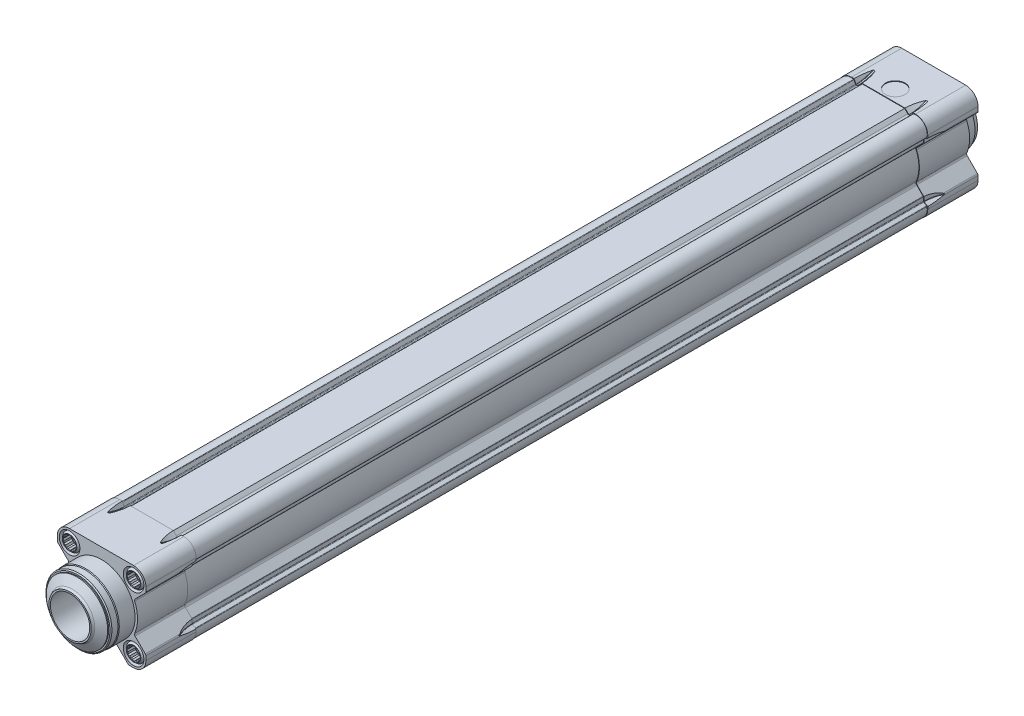
from build123d import *

# Parameters (mm, degrees)
BOSS_EXTRUDE1_DEPTH  = 25.5
SKETCH6_W            = 371.5
SKETCH6_H            = 5
BOSS_EXTRUDE2_START  = -25.5
BOSS_EXTRUDE2_DEPTH  = 25.5
BOSS_EXTRUDE3_DEPTH  = 371.5
SKETCH14_W           = 5
SKETCH14_H           = 0.3
SKETCH15_W           = 21.1
SKETCH15_H           = 5.25
LPATTERN1_COUNT      = 2
LPATTERN1_PITCH      = 32.5
LPATTERN1_COUNT_DIR2 = 2
LPATTERN1_PITCH_DIR2 = 32.5
LPATTERN2_COUNT      = 2
LPATTERN2_PITCH      = 32.5
LPATTERN2_COUNT_DIR2 = 2
LPATTERN2_PITCH_DIR2 = 32.5
CUT_EXTRUDE1_DEPTH   = 4
LPATTERN3_COUNT      = 2
LPATTERN3_PITCH      = 32.5
LPATTERN3_COUNT_DIR2 = 2
LPATTERN3_PITCH_DIR2 = 32.5
LPATTERN4_COUNT      = 2
LPATTERN4_PITCH      = 32.5
LPATTERN4_COUNT_DIR2 = 2
LPATTERN4_PITCH_DIR2 = 32.5
SKETCH25_W           = 21.1
SKETCH25_H           = 5.25
LPATTERN5_COUNT      = 2
LPATTERN5_PITCH      = 32.5
LPATTERN5_COUNT_DIR2 = 2
LPATTERN5_PITCH_DIR2 = 32.5
LPATTERN6_COUNT      = 2
LPATTERN6_PITCH      = 32.5
LPATTERN6_COUNT_DIR2 = 2
LPATTERN6_PITCH_DIR2 = 32.5
LPATTERN7_COUNT      = 2
LPATTERN7_PITCH      = 32.5
LPATTERN7_COUNT_DIR2 = 2
LPATTERN7_PITCH_DIR2 = 32.5
CUT_EXTRUDE2_DEPTH   = 4
LPATTERN8_COUNT      = 2
LPATTERN8_PITCH      = 32.5
LPATTERN8_COUNT_DIR2 = 2
LPATTERN8_PITCH_DIR2 = 32.5


with BuildPart() as part:
    # Sketch1 → Boss-Extrude1 (new body)
    with BuildSketch(Plane.XY.offset(-25.5)):
        with BuildLine():
            Line((-22.207106781, 13.368272016), (-17.028937595, 8.190102831))
            ThreePointArc((-17.028937595, 8.190102831), (-16.754625387, 7.674873005), (-16.814691422, 7.094268982))
            ThreePointArc((-16.814691422, 7.094268982), (-18.25, 0), (-16.814691422, -7.094268982))
            ThreePointArc((-16.814691422, -7.094268982), (-16.754625387, -7.674873005), (-17.028937595, -8.190102831))
            Line((-17.028937595, -8.190102831), (-22.207106781, -13.368272016))
            ThreePointArc((-22.207106781, -13.368272016), (-22.423879533, -13.692695365), (-22.5, -14.075378798))
            Line((-22.5, -14.075378798), (-22.5, -16.25))
            ThreePointArc((-22.5, -16.25), (-20.669417382, -20.669417382), (-16.25, -22.5))
            Line((-16.25, -22.5), (-14.075378798, -22.5))
            ThreePointArc((-14.075378798, -22.5), (-13.692695365, -22.423879533), (-13.368272016, -22.207106781))
            Line((-13.368272016, -22.207106781), (-8.190102831, -17.028937595))
            ThreePointArc((-8.190102831, -17.028937595), (-7.674873005, -16.754625387), (-7.094268982, -16.814691422))
            ThreePointArc((-7.094268982, -16.814691422), (0, -18.25), (7.094268982, -16.814691422))
            ThreePointArc((7.094268982, -16.814691422), (7.674873005, -16.754625387), (8.190102831, -17.028937595))
            Line((8.190102831, -17.028937595), (13.368272016, -22.207106781))
            ThreePointArc((13.368272016, -22.207106781), (13.692695365, -22.423879533), (14.075378798, -22.5))
            Line((14.075378798, -22.5), (16.25, -22.5))
            ThreePointArc((16.25, -22.5), (20.669417382, -20.669417382), (22.5, -16.25))
            Line((22.5, -16.25), (22.5, -14.075378798))
            ThreePointArc((22.5, -14.075378798), (22.423879533, -13.692695365), (22.207106781, -13.368272016))
            Line((22.207106781, -13.368272016), (17.028937595, -8.190102831))
            ThreePointArc((17.028937595, -8.190102831), (16.754625387, -7.674873005), (16.814691422, -7.094268982))
            ThreePointArc((16.814691422, -7.094268982), (18.25, 0), (16.814691422, 7.094268982))
            ThreePointArc((16.814691422, 7.094268982), (16.754625387, 7.674873005), (17.028937595, 8.190102831))
            Line((17.028937595, 8.190102831), (22.207106781, 13.368272016))
            ThreePointArc((22.207106781, 13.368272016), (22.423879533, 13.692695365), (22.5, 14.075378798))
            Line((22.5, 14.075378798), (22.5, 16.25))
            ThreePointArc((22.5, 16.25), (20.669417382, 20.669417382), (16.25, 22.5))
            Line((16.25, 22.5), (-16.25, 22.5))
            ThreePointArc((-16.25, 22.5), (-20.669417382, 20.669417382), (-22.5, 16.25))
            Line((-22.5, 16.25), (-22.5, 14.075378798))
            ThreePointArc((-22.5, 14.075378798), (-22.423879533, 13.692695365), (-22.207106781, 13.368272016))
        make_face()
    extrude(amount=BOSS_EXTRUDE1_DEPTH)

    # Sketch2 → Cut-Revolve1 (revolve, cut)
    with BuildSketch(Plane.XY.offset(-25.5)):
        with BuildLine():
            Line((-15, 28.125), (-15, 22.5))
            Line((-15, 22.5), (-13.903034489, 20.6))
            ThreePointArc((-13.903034489, 20.6), (-13.829829408, 20.526794919), (-13.729829408, 20.5))
            Line((-13.729829408, 20.5), (-13.028142174, 20.5))
            ThreePointArc((-13.028142174, 20.5), (-12.951605488, 20.515224093), (-12.886720818, 20.558578644))
            Line((-12.886720818, 20.558578644), (-10.945299462, 22.5))
            Line((-10.945299462, 22.5), (10.945299462, 22.5))
            Line((10.945299462, 22.5), (12.886720818, 20.558578644))
            ThreePointArc((12.886720818, 20.558578644), (12.951605488, 20.515224093), (13.028142174, 20.5))
            Line((13.028142174, 20.5), (13.729829408, 20.5))
            ThreePointArc((13.729829408, 20.5), (13.829829408, 20.526794919), (13.903034489, 20.6))
            Line((13.903034489, 20.6), (15, 22.5))
            Line((15, 22.5), (15, 28.125))
            Line((15, 28.125), (-15, 28.125))
        make_face()
    revolve(axis=Axis((-50, 40.5, -25.5), (1, 0, 0)), mode=Mode.SUBTRACT)

    # Sketch3 → Cut-Revolve2 (revolve, cut)
    with BuildSketch(Plane.XY.offset(-25.5)):
        with BuildLine():
            Line((-15, -28.125), (15, -28.125))
            Line((15, -28.125), (15, -22.5))
            Line((15, -22.5), (13.903034489, -20.6))
            ThreePointArc((13.903034489, -20.6), (13.829829408, -20.526794919), (13.729829408, -20.5))
            Line((13.729829408, -20.5), (5.595757321, -20.5))
            ThreePointArc((5.595757321, -20.5), (0, -21.25), (-5.595757321, -20.5))
            Line((-5.595757321, -20.5), (-13.729829408, -20.5))
            ThreePointArc((-13.729829408, -20.5), (-13.829829408, -20.526794919), (-13.903034489, -20.6))
            Line((-13.903034489, -20.6), (-15, -22.5))
            Line((-15, -22.5), (-15, -28.125))
        make_face()
    revolve(axis=Axis((50, -40.5, -25.5), (-1, 0, 0)), mode=Mode.SUBTRACT)

    # Sketch4 → Cut-Revolve3 (revolve, cut)
    with BuildSketch(Plane.XY.offset(-25.5)):
        with BuildLine():
            Line((20.5, -5.595757321), (20.5, -13.729829408))
            ThreePointArc((20.5, -13.729829408), (20.526794919, -13.829829408), (20.6, -13.903034489))
            Line((20.6, -13.903034489), (22.5, -15))
            Line((22.5, -15), (28.125, -15))
            Line((28.125, -15), (28.125, 15))
            Line((28.125, 15), (22.5, 15))
            Line((22.5, 15), (20.6, 13.903034489))
            ThreePointArc((20.6, 13.903034489), (20.526794919, 13.829829408), (20.5, 13.729829408))
            Line((20.5, 13.729829408), (20.5, 5.595757321))
            ThreePointArc((20.5, 5.595757321), (21.25, 0), (20.5, -5.595757321))
        make_face()
    revolve(axis=Axis((40.5, 50, -25.5), (0, -1, 0)), mode=Mode.SUBTRACT)

    # Sketch5 → Cut-Revolve4 (revolve, cut)
    with BuildSketch(Plane.XY.offset(-25.5)):
        with BuildLine():
            Line((-28.125, -15), (-22.5, -15))
            Line((-22.5, -15), (-20.6, -13.903034489))
            ThreePointArc((-20.6, -13.903034489), (-20.526794919, -13.829829408), (-20.5, -13.729829408))
            Line((-20.5, -13.729829408), (-20.5, -5.595757321))
            ThreePointArc((-20.5, -5.595757321), (-21.25, 0), (-20.5, 5.595757321))
            Line((-20.5, 5.595757321), (-20.5, 13.729829408))
            ThreePointArc((-20.5, 13.729829408), (-20.526794919, 13.829829408), (-20.6, 13.903034489))
            Line((-20.6, 13.903034489), (-22.5, 15))
            Line((-22.5, 15), (-28.125, 15))
            Line((-28.125, 15), (-28.125, -15))
        make_face()
    revolve(axis=Axis((-40.5, -50, -25.5), (0, 1, 0)), mode=Mode.SUBTRACT)

    # Sketch6 → Revolve1 (revolve)
    with BuildSketch(Plane(origin=(0, 0, 0), x_dir=(0, 0, -1), z_dir=(1, 0, 0))):
        with Locations((211.25, 2.5)):
            Rectangle(SKETCH6_W, SKETCH6_H)
    revolve(axis=Axis((0, 0, -397), (0, 0, 1)))

    # Sketch7 → Boss-Extrude2 (add)
    with BuildSketch(Plane.XY.offset(-397).offset(BOSS_EXTRUDE2_START)):
        with BuildLine():
            Line((-22.207106781, 13.368272016), (-17.028937595, 8.190102831))
            ThreePointArc((-17.028937595, 8.190102831), (-16.754625387, 7.674873005), (-16.814691422, 7.094268982))
            ThreePointArc((-16.814691422, 7.094268982), (-18.25, 0), (-16.814691422, -7.094268982))
            ThreePointArc((-16.814691422, -7.094268982), (-16.754625387, -7.674873005), (-17.028937595, -8.190102831))
            Line((-17.028937595, -8.190102831), (-22.207106781, -13.368272016))
            ThreePointArc((-22.207106781, -13.368272016), (-22.423879533, -13.692695365), (-22.5, -14.075378798))
            Line((-22.5, -14.075378798), (-22.5, -16.25))
            ThreePointArc((-22.5, -16.25), (-20.669417382, -20.669417382), (-16.25, -22.5))
            Line((-16.25, -22.5), (-14.075378798, -22.5))
            ThreePointArc((-14.075378798, -22.5), (-13.692695365, -22.423879533), (-13.368272016, -22.207106781))
            Line((-13.368272016, -22.207106781), (-8.190102831, -17.028937595))
            ThreePointArc((-8.190102831, -17.028937595), (-7.674873005, -16.754625387), (-7.094268982, -16.814691422))
            ThreePointArc((-7.094268982, -16.814691422), (0, -18.25), (7.094268982, -16.814691422))
            ThreePointArc((7.094268982, -16.814691422), (7.674873005, -16.754625387), (8.190102831, -17.028937595))
            Line((8.190102831, -17.028937595), (13.368272016, -22.207106781))
            ThreePointArc((13.368272016, -22.207106781), (13.692695365, -22.423879533), (14.075378798, -22.5))
            Line((14.075378798, -22.5), (16.25, -22.5))
            ThreePointArc((16.25, -22.5), (20.669417382, -20.669417382), (22.5, -16.25))
            Line((22.5, -16.25), (22.5, -14.075378798))
            ThreePointArc((22.5, -14.075378798), (22.423879533, -13.692695365), (22.207106781, -13.368272016))
            Line((22.207106781, -13.368272016), (17.028937595, -8.190102831))
            ThreePointArc((17.028937595, -8.190102831), (16.754625387, -7.674873005), (16.814691422, -7.094268982))
            ThreePointArc((16.814691422, -7.094268982), (18.25, 0), (16.814691422, 7.094268982))
            ThreePointArc((16.814691422, 7.094268982), (16.754625387, 7.674873005), (17.028937595, 8.190102831))
            Line((17.028937595, 8.190102831), (22.207106781, 13.368272016))
            ThreePointArc((22.207106781, 13.368272016), (22.423879533, 13.692695365), (22.5, 14.075378798))
            Line((22.5, 14.075378798), (22.5, 16.25))
            ThreePointArc((22.5, 16.25), (20.669417382, 20.669417382), (16.25, 22.5))
            Line((16.25, 22.5), (-16.25, 22.5))
            ThreePointArc((-16.25, 22.5), (-20.669417382, 20.669417382), (-22.5, 16.25))
            Line((-22.5, 16.25), (-22.5, 14.075378798))
            ThreePointArc((-22.5, 14.075378798), (-22.423879533, 13.692695365), (-22.207106781, 13.368272016))
        make_face()
    extrude(amount=BOSS_EXTRUDE2_DEPTH)

    # Sketch8 → Cut-Revolve5 (revolve, cut)
    with BuildSketch(Plane.XY.offset(-397)):
        with BuildLine():
            Line((-15, 28.125), (-15, 22.5))
            Line((-15, 22.5), (-13.903034489, 20.6))
            ThreePointArc((-13.903034489, 20.6), (-13.829829408, 20.526794919), (-13.729829408, 20.5))
            Line((-13.729829408, 20.5), (-13.028142174, 20.5))
            ThreePointArc((-13.028142174, 20.5), (-12.951605488, 20.515224093), (-12.886720818, 20.558578644))
            Line((-12.886720818, 20.558578644), (-10.945299462, 22.5))
            Line((-10.945299462, 22.5), (10.945299462, 22.5))
            Line((10.945299462, 22.5), (12.886720818, 20.558578644))
            ThreePointArc((12.886720818, 20.558578644), (12.951605488, 20.515224093), (13.028142174, 20.5))
            Line((13.028142174, 20.5), (13.729829408, 20.5))
            ThreePointArc((13.729829408, 20.5), (13.829829408, 20.526794919), (13.903034489, 20.6))
            Line((13.903034489, 20.6), (15, 22.5))
            Line((15, 22.5), (15, 28.125))
            Line((15, 28.125), (-15, 28.125))
        make_face()
    revolve(axis=Axis((-50, 40.5, -397), (1, 0, 0)), mode=Mode.SUBTRACT)

    # Sketch9 → Cut-Revolve6 (revolve, cut)
    with BuildSketch(Plane.XY.offset(-397)):
        with BuildLine():
            Line((-15, -30), (15, -30))
            Line((15, -30), (15, -22.5))
            Line((15, -22.5), (13.903034489, -20.6))
            ThreePointArc((13.903034489, -20.6), (13.829829408, -20.526794919), (13.729829408, -20.5))
            Line((13.729829408, -20.5), (5.595757321, -20.5))
            ThreePointArc((5.595757321, -20.5), (0, -21.25), (-5.595757321, -20.5))
            Line((-5.595757321, -20.5), (-13.729829408, -20.5))
            ThreePointArc((-13.729829408, -20.5), (-13.829829408, -20.526794919), (-13.903034489, -20.6))
            Line((-13.903034489, -20.6), (-15, -22.5))
            Line((-15, -22.5), (-15, -30))
        make_face()
    revolve(axis=Axis((50, -40.5, -397), (-1, 0, 0)), mode=Mode.SUBTRACT)

    # Sketch10 → Cut-Revolve7 (revolve, cut)
    with BuildSketch(Plane.XY.offset(-397)):
        with BuildLine():
            Line((20.5, -5.595757321), (20.5, -13.729829408))
            ThreePointArc((20.5, -13.729829408), (20.526794919, -13.829829408), (20.6, -13.903034489))
            Line((20.6, -13.903034489), (22.5, -15))
            Line((22.5, -15), (28.125, -15))
            Line((28.125, -15), (28.125, 15))
            Line((28.125, 15), (22.5, 15))
            Line((22.5, 15), (20.6, 13.903034489))
            ThreePointArc((20.6, 13.903034489), (20.526794919, 13.829829408), (20.5, 13.729829408))
            Line((20.5, 13.729829408), (20.5, 5.595757321))
            ThreePointArc((20.5, 5.595757321), (21.25, 0), (20.5, -5.595757321))
        make_face()
    revolve(axis=Axis((40.5, 50, -397), (0, -1, 0)), mode=Mode.SUBTRACT)

    # Sketch11 → Cut-Revolve8 (revolve, cut)
    with BuildSketch(Plane.XY.offset(-397)):
        with BuildLine():
            Line((-28.125, -15), (-22.5, -15))
            Line((-22.5, -15), (-20.6, -13.903034489))
            ThreePointArc((-20.6, -13.903034489), (-20.526794919, -13.829829408), (-20.5, -13.729829408))
            Line((-20.5, -13.729829408), (-20.5, -5.595757321))
            ThreePointArc((-20.5, -5.595757321), (-21.25, 0), (-20.5, 5.595757321))
            Line((-20.5, 5.595757321), (-20.5, 13.729829408))
            ThreePointArc((-20.5, 13.729829408), (-20.526794919, 13.829829408), (-20.6, 13.903034489))
            Line((-20.6, 13.903034489), (-22.5, 15))
            Line((-22.5, 15), (-28.125, 15))
            Line((-28.125, 15), (-28.125, -15))
        make_face()
    revolve(axis=Axis((-40.5, -50, -397), (0, 1, 0)), mode=Mode.SUBTRACT)

    # Sketch12 → Boss-Extrude3 (add)
    with BuildSketch(Plane.XY.offset(-25.5)):
        with BuildLine():
            Line((-14.989450492, -21.921808076), (-14.139701704, -20.45))
            ThreePointArc((-14.139701704, -20.45), (-13.993291542, -20.303589838), (-13.793291542, -20.25))
            Line((-13.793291542, -20.25), (-11.930404051, -20.25))
            ThreePointArc((-11.930404051, -20.25), (-11.777330678, -20.219551813), (-11.647561338, -20.132842712))
            Line((-11.647561338, -20.132842712), (-8.485281374, -16.970562748))
            ThreePointArc((-8.485281374, -16.970562748), (-7.718795405, -16.560351907), (-6.853496495, -16.644205773))
            ThreePointArc((-6.853496495, -16.644205773), (0, -18), (6.853496495, -16.644205773))
            ThreePointArc((6.853496495, -16.644205773), (7.718795405, -16.560351907), (8.485281374, -16.970562748))
            Line((8.485281374, -16.970562748), (11.647561338, -20.132842712))
            ThreePointArc((11.647561338, -20.132842712), (11.777330678, -20.219551813), (11.930404051, -20.25))
            Line((11.930404051, -20.25), (13.793291542, -20.25))
            ThreePointArc((13.793291542, -20.25), (13.993291542, -20.303589838), (14.139701704, -20.45))
            Line((14.139701704, -20.45), (14.989450492, -21.921808076))
            ThreePointArc((14.989450492, -21.921808076), (15.099145747, -22.044245749), (15.248822198, -22.112223633))
            ThreePointArc((15.248822198, -22.112223633), (20.565863992, -20.565863992), (22.112223633, -15.248822198))
            ThreePointArc((22.112223633, -15.248822198), (22.044245749, -15.099145747), (21.921808076, -14.989450492))
            Line((21.921808076, -14.989450492), (20.45, -14.139701704))
            ThreePointArc((20.45, -14.139701704), (20.303589838, -13.993291542), (20.25, -13.793291542))
            Line((20.25, -13.793291542), (20.25, -11.930404051))
            ThreePointArc((20.25, -11.930404051), (20.219551813, -11.777330678), (20.132842712, -11.647561338))
            Line((20.132842712, -11.647561338), (16.970562748, -8.485281374))
            ThreePointArc((16.970562748, -8.485281374), (16.560351907, -7.718795405), (16.644205773, -6.853496495))
            ThreePointArc((16.644205773, -6.853496495), (17.993205506, 0.49452566), (16.242640687, 7.757359313))
            Line((16.242640687, 7.757359313), (20.132842712, 11.647561338))
            ThreePointArc((20.132842712, 11.647561338), (20.219551813, 11.777330678), (20.25, 11.930404051))
            Line((20.25, 11.930404051), (20.25, 13.793291542))
            ThreePointArc((20.25, 13.793291542), (20.303589838, 13.993291542), (20.45, 14.139701704))
            Line((20.45, 14.139701704), (21.921808076, 14.989450492))
            ThreePointArc((21.921808076, 14.989450492), (22.044245749, 15.099145747), (22.112223633, 15.248822198))
            ThreePointArc((22.112223633, 15.248822198), (20.565863992, 20.565863992), (15.248822198, 22.112223633))
            ThreePointArc((15.248822198, 22.112223633), (15.099145747, 22.044245749), (14.989450492, 21.921808076))
            Line((14.989450492, 21.921808076), (14.139701704, 20.45))
            ThreePointArc((14.139701704, 20.45), (13.993291542, 20.303589838), (13.793291542, 20.25))
            Line((13.793291542, 20.25), (13.371320344, 20.25))
            ThreePointArc((13.371320344, 20.25), (12.797295195, 20.364180701), (12.310660172, 20.689339828))
            Line((12.310660172, 20.689339828), (10.75, 22.25))
            Line((10.75, 22.25), (-10.75, 22.25))
            Line((-10.75, 22.25), (-12.310660172, 20.689339828))
            ThreePointArc((-12.310660172, 20.689339828), (-12.797295195, 20.364180701), (-13.371320344, 20.25))
            Line((-13.371320344, 20.25), (-13.793291542, 20.25))
            ThreePointArc((-13.793291542, 20.25), (-13.993291542, 20.303589838), (-14.139701704, 20.45))
            Line((-14.139701704, 20.45), (-14.989450492, 21.921808076))
            ThreePointArc((-14.989450492, 21.921808076), (-15.099145747, 22.044245749), (-15.248822198, 22.112223633))
            ThreePointArc((-15.248822198, 22.112223633), (-20.565863992, 20.565863992), (-22.112223633, 15.248822198))
            ThreePointArc((-22.112223633, 15.248822198), (-22.044245749, 15.099145747), (-21.921808076, 14.989450492))
            Line((-21.921808076, 14.989450492), (-20.45, 14.139701704))
            ThreePointArc((-20.45, 14.139701704), (-20.303589838, 13.993291542), (-20.25, 13.793291542))
            Line((-20.25, 13.793291542), (-20.25, 11.930404051))
            ThreePointArc((-20.25, 11.930404051), (-20.219551813, 11.777330678), (-20.132842712, 11.647561338))
            Line((-20.132842712, 11.647561338), (-16.242640687, 7.757359313))
            ThreePointArc((-16.242640687, 7.757359313), (-17.993205506, 0.49452566), (-16.644205773, -6.853496495))
            ThreePointArc((-16.644205773, -6.853496495), (-16.560351907, -7.718795405), (-16.970562748, -8.485281374))
            Line((-16.970562748, -8.485281374), (-20.132842712, -11.647561338))
            ThreePointArc((-20.132842712, -11.647561338), (-20.219551813, -11.777330678), (-20.25, -11.930404051))
            Line((-20.25, -11.930404051), (-20.25, -13.793291542))
            ThreePointArc((-20.25, -13.793291542), (-20.303589838, -13.993291542), (-20.45, -14.139701704))
            Line((-20.45, -14.139701704), (-21.921808076, -14.989450492))
            ThreePointArc((-21.921808076, -14.989450492), (-22.044245749, -15.099145747), (-22.112223633, -15.248822198))
            ThreePointArc((-22.112223633, -15.248822198), (-20.565863992, -20.565863992), (-15.248822198, -22.112223633))
            ThreePointArc((-15.248822198, -22.112223633), (-15.099145747, -22.044245749), (-14.989450492, -21.921808076))
        make_face()
    extrude(amount=-BOSS_EXTRUDE3_DEPTH)

    # Sketch13 → Revolve2 (revolve)
    with BuildSketch(Plane(origin=(0, 0, 0), x_dir=(0, 0, -1), z_dir=(1, 0, 0))):
        with BuildLine():
            Line((-16, 0), (-16, 10.75))
            ThreePointArc((-16, 10.75), (-15.344877002, 10.927140321), (-14.868290464, 11.410286373))
            Line((-14.868290464, 11.410286373), (-12.5, 15.6))
            Line((-12.5, 15.6), (-12, 15.6))
            Line((-12, 15.6), (-12, 16.25))
            Line((-12, 16.25), (-11.5, 16.75))
            Line((-11.5, 16.75), (-8.433012702, 16.75))
            Line((-8.433012702, 16.75), (-8, 17))
            Line((-8, 17), (0, 17))
            Line((0, 17), (0, 0))
            Line((0, 0), (-16, 0))
        make_face()
    revolve(axis=Axis((0, 0, 0), (0, 0, 1)))

    # Sketch14 → Cut-Revolve9 (revolve, cut)
    with BuildSketch(Plane.XY.offset(-403)):
        with Locations((2.5, 22.35)):
            Rectangle(SKETCH14_W, SKETCH14_H)
    revolve(axis=Axis((0, 22.2, -403), (0, 1, 0)), mode=Mode.SUBTRACT)

    # Sketch15 → Cut-Revolve10 (revolve, cut)
    with BuildSketch(Plane(origin=(16.25, 0, 0), x_dir=(0, 0, -1), z_dir=(1, 0, 0))):
        with Locations((10.55, 18.875)):
            Rectangle(SKETCH15_W, SKETCH15_H)
    cut_revolve10 = revolve(axis=Axis((16.25, 16.25, -21.1), (0, 0, 1)), mode=Mode.SUBTRACT)

    # LPattern1: Cut-Revolve10 2 × 2
    with Locations(*[(-i * LPATTERN1_PITCH, -j * LPATTERN1_PITCH_DIR2, 0) for i in range(LPATTERN1_COUNT) for j in range(LPATTERN1_COUNT_DIR2) if (i, j) != (0, 0)]):
        add(cut_revolve10, mode=Mode.SUBTRACT)

    # Sketch17 → Revolve3 (revolve)
    with BuildSketch(Plane(origin=(16.25, 0, 0), x_dir=(0, 0, -1), z_dir=(1, 0, 0))):
        Polygon((0, 16.25), (0, 19.910900369), (1, 20.75), (21.1, 20.75), (21.1, 16.25), align=None)
    revolve3 = revolve(axis=Axis((16.25, 16.25, -21.1), (0, 0, 1)))

    # LPattern2: Revolve3 2 × 2
    with Locations(*[(-i * LPATTERN2_PITCH, -j * LPATTERN2_PITCH_DIR2, 0) for i in range(LPATTERN2_COUNT) for j in range(LPATTERN2_COUNT_DIR2) if (i, j) != (0, 0)]):
        add(revolve3)

    # Sketch19 → Cut-Revolve11 (revolve, cut)
    with BuildSketch(Plane(origin=(16.25, 0, 0), x_dir=(0, 0, -1), z_dir=(1, 0, 0))):
        Polygon((0, 16.25), (0, 19.75), (0.288675135, 19.25), (5.5, 19.25), (6.0415, 18.7085), (18.7, 18.7085), (20.119415637, 16.25), align=None)
    cut_revolve11 = revolve(axis=Axis((16.25, 16.25, -20.119415637), (0, 0, 1)), mode=Mode.SUBTRACT)

    # Sketch20 → Cut-Extrude1 (cut, symmetric)
    with BuildSketch(Plane.XY):
        Polygon((12.785898385, 16.25), (13.25, 15.446152423), (13.25, 14.517949192), (14.053847577, 14.053847577), (14.517949192, 13.25), (15.446152423, 13.25), (16.25, 12.785898385), (17.053847577, 13.25), (17.982050808, 13.25), (18.446152423, 14.053847577), (19.25, 14.517949192), (19.25, 15.446152423), (19.714101615, 16.25), (19.25, 17.053847577), (19.25, 17.982050808), (18.446152423, 18.446152423), (17.982050808, 19.25), (17.053847577, 19.25), (16.25, 19.714101615), (15.446152423, 19.25), (14.517949192, 19.25), (14.053847577, 18.446152423), (13.25, 17.982050808), (13.25, 17.053847577), align=None)
    cut_extrude1 = extrude(amount=CUT_EXTRUDE1_DEPTH, both=True, mode=Mode.SUBTRACT)

    # LPattern3: Cut-Revolve11 2 × 2
    with Locations(*[(-i * LPATTERN3_PITCH, -j * LPATTERN3_PITCH_DIR2, 0) for i in range(LPATTERN3_COUNT) for j in range(LPATTERN3_COUNT_DIR2) if (i, j) != (0, 0)]):
        add(cut_revolve11, mode=Mode.SUBTRACT)

    # LPattern4: Cut-Extrude1 2 × 2
    with Locations(*[(-i * LPATTERN4_PITCH, -j * LPATTERN4_PITCH_DIR2, 0) for i in range(LPATTERN4_COUNT) for j in range(LPATTERN4_COUNT_DIR2) if (i, j) != (0, 0)]):
        add(cut_extrude1, mode=Mode.SUBTRACT)

    # Sketch23 → Revolve4 (revolve)
    with BuildSketch(Plane(origin=(0, 0, 0), x_dir=(0, 0, -1), z_dir=(1, 0, 0))):
        Polygon((422.5, 0), (422.5, 16), (427.5, 16), (429.5, 15.272059531), (429.5, 0), align=None)
    revolve(axis=Axis((0, 0, -429.5), (0, 0, 1)))

    # Sketch24 → Cut-Revolve12 (revolve, cut)
    with BuildSketch(Plane(origin=(0, 0, 0), x_dir=(0, 0, -1), z_dir=(1, 0, 0))):
        Polygon((397, 0), (397, 4), (424.24, 4), (424.24, 12), (428.5, 12), (429.5, 12.363970234), (429.5, 0), align=None)
    revolve(axis=Axis((0, 0, -429.5), (0, 0, 1)), mode=Mode.SUBTRACT)

    # Sketch25 → Cut-Revolve13 (revolve, cut)
    with BuildSketch(Plane(origin=(16.25, 0, 0), x_dir=(0, 0, -1), z_dir=(1, 0, 0))):
        with Locations((411.95, 18.875)):
            Rectangle(SKETCH25_W, SKETCH25_H)
    cut_revolve13 = revolve(axis=Axis((16.25, 16.25, -422.5), (0, 0, 1)), mode=Mode.SUBTRACT)

    # LPattern5: Cut-Revolve13 2 × 2
    with Locations(*[(-i * LPATTERN5_PITCH, -j * LPATTERN5_PITCH_DIR2, 0) for i in range(LPATTERN5_COUNT) for j in range(LPATTERN5_COUNT_DIR2) if (i, j) != (0, 0)]):
        add(cut_revolve13, mode=Mode.SUBTRACT)

    # Sketch27 → Revolve5 (revolve)
    with BuildSketch(Plane(origin=(16.25, 0, 0), x_dir=(0, 0, -1), z_dir=(1, 0, 0))):
        Polygon((401.4, 16.25), (401.4, 20.75), (421.5, 20.75), (422.5, 19.910900369), (422.5, 16.25), align=None)
    revolve5 = revolve(axis=Axis((16.25, 16.25, -422.5), (0, 0, 1)))

    # LPattern6: Revolve5 2 × 2
    with Locations(*[(-i * LPATTERN6_PITCH, -j * LPATTERN6_PITCH_DIR2, 0) for i in range(LPATTERN6_COUNT) for j in range(LPATTERN6_COUNT_DIR2) if (i, j) != (0, 0)]):
        add(revolve5)

    # Sketch29 → Cut-Revolve14 (revolve, cut)
    with BuildSketch(Plane(origin=(16.25, 0, 0), x_dir=(0, 0, -1), z_dir=(1, 0, 0))):
        Polygon((402.380584363, 16.25), (403.8, 18.7085), (416.4585, 18.7085), (417, 19.25), (422.211324865, 19.25), (422.5, 19.75), (422.5, 16.25), align=None)
    cut_revolve14 = revolve(axis=Axis((16.25, 16.25, -422.5), (0, 0, 1)), mode=Mode.SUBTRACT)

    # LPattern7: Cut-Revolve14 2 × 2
    with Locations(*[(-i * LPATTERN7_PITCH, -j * LPATTERN7_PITCH_DIR2, 0) for i in range(LPATTERN7_COUNT) for j in range(LPATTERN7_COUNT_DIR2) if (i, j) != (0, 0)]):
        add(cut_revolve14, mode=Mode.SUBTRACT)

    # Sketch31 → Cut-Extrude2 (cut, symmetric)
    with BuildSketch(Plane.XY.offset(-422.5)):
        Polygon((12.785898385, 16.25), (13.25, 15.446152423), (13.25, 14.517949192), (14.053847577, 14.053847577), (14.517949192, 13.25), (15.446152423, 13.25), (16.25, 12.785898385), (17.053847577, 13.25), (17.982050808, 13.25), (18.446152423, 14.053847577), (19.25, 14.517949192), (19.25, 15.446152423), (19.714101615, 16.25), (19.25, 17.053847577), (19.25, 17.982050808), (18.446152423, 18.446152423), (17.982050808, 19.25), (17.053847577, 19.25), (16.25, 19.714101615), (15.446152423, 19.25), (14.517949192, 19.25), (14.053847577, 18.446152423), (13.25, 17.982050808), (13.25, 17.053847577), align=None)
    cut_extrude2 = extrude(amount=CUT_EXTRUDE2_DEPTH, both=True, mode=Mode.SUBTRACT)

    # LPattern8: Cut-Extrude2 2 × 2
    with Locations(*[(-i * LPATTERN8_PITCH, -j * LPATTERN8_PITCH_DIR2, 0) for i in range(LPATTERN8_COUNT) for j in range(LPATTERN8_COUNT_DIR2) if (i, j) != (0, 0)]):
        add(cut_extrude2, mode=Mode.SUBTRACT)

    # Sketch33 → Cut-Revolve15 (revolve, cut)
    with BuildSketch(Plane(origin=(0, 0, 0), x_dir=(0, 0, -1), z_dir=(1, 0, 0))):
        Polygon((-16, 0), (-16, 10), (86.333333333, 10), (86.333333333, 16), (397, 16), (397, 0), align=None)
    revolve(axis=Axis((0, 0, -397), (0, 0, 1)), mode=Mode.SUBTRACT)


solid = part.part
